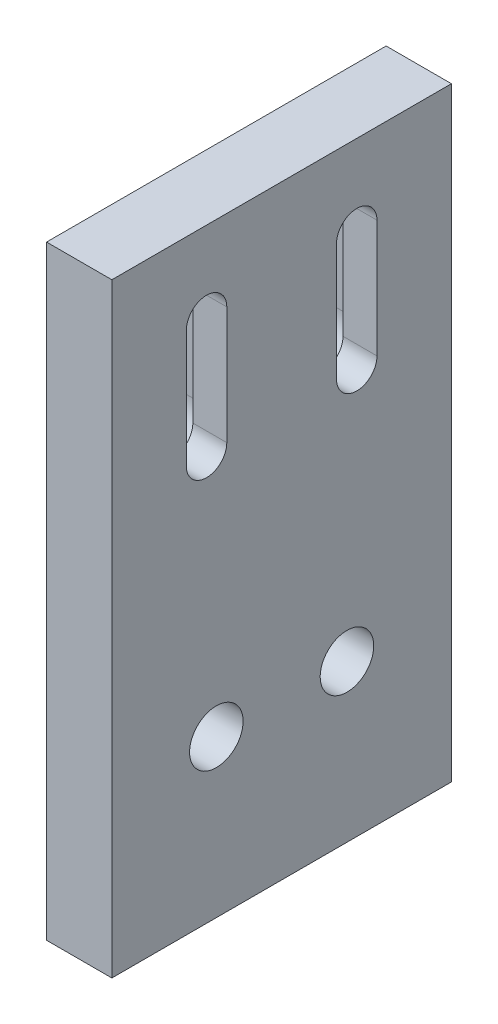
from build123d import *

# Parameters (mm, degrees)
PROFILESKETCH1_W                          = 5
PROFILESKETCH1_H                          = 46.3
BOSS_EXTRUDE1_DEPTH                       = 26
PROBESLIDINGMOUNTSKETCH4_R                = 2.05
PROBESLIDINGMOUNTCUT_EXTRUDE3_DEPTH       = 54.335635367
PROBESLIDINGMOUNTCHANELCUT_EXTRUDE4_DEPTH = 2.4


with BuildPart() as part:
    # ProfileSketch1 → Boss-Extrude1 (new body)
    with BuildSketch(Plane.XY):
        with Locations((2.5, 23.15)):
            Rectangle(PROFILESKETCH1_W, PROFILESKETCH1_H)
    extrude(amount=BOSS_EXTRUDE1_DEPTH)

    # ProbeSlidingMountSketch4 → ProbeSlidingMountCut-Extrude3 (cut, through all)
    with BuildSketch(Plane.ZY):
        with Locations((8, 12)):
            Circle(PROBESLIDINGMOUNTSKETCH4_R)
        with Locations((18, 12)):
            Circle(PROBESLIDINGMOUNTSKETCH4_R)
        with BuildLine():
            Line((5.7, 40.1), (5.7, 31.1))
            ThreePointArc((5.7, 31.1), (7.25, 29.55), (8.8, 31.1))
            Line((8.8, 31.1), (8.8, 40.1))
            ThreePointArc((8.8, 40.1), (7.25, 41.65), (5.7, 40.1))
        make_face()
        with BuildLine():
            Line((17.2, 40.1), (17.2, 31.1))
            ThreePointArc((17.2, 31.1), (18.75, 29.55), (20.3, 31.1))
            Line((20.3, 31.1), (20.3, 40.1))
            ThreePointArc((20.3, 40.1), (18.75, 41.65), (17.2, 40.1))
        make_face()
    extrude(amount=-PROBESLIDINGMOUNTCUT_EXTRUDE3_DEPTH, mode=Mode.SUBTRACT)

    # ProbeSlidingMountChannelSketch5 → ProbeSlidingMountChanelCut-Extrude4 (cut)
    with BuildSketch(Plane.ZY):
        with BuildLine():
            Line((10.45, 40.1), (10.45, 31.1))
            ThreePointArc((10.45, 31.1), (7.25, 27.9), (4.05, 31.1))
            Line((4.05, 31.1), (4.05, 40.1))
            ThreePointArc((4.05, 40.1), (7.25, 43.3), (10.45, 40.1))
        make_face()
        with BuildLine():
            Line((21.95, 40.1), (21.95, 31.1))
            ThreePointArc((21.95, 31.1), (18.75, 27.9), (15.55, 31.1))
            Line((15.55, 31.1), (15.55, 40.1))
            ThreePointArc((15.55, 40.1), (18.75, 43.3), (21.95, 40.1))
        make_face()
    extrude(amount=-PROBESLIDINGMOUNTCHANELCUT_EXTRUDE4_DEPTH, mode=Mode.SUBTRACT)


solid = part.part
